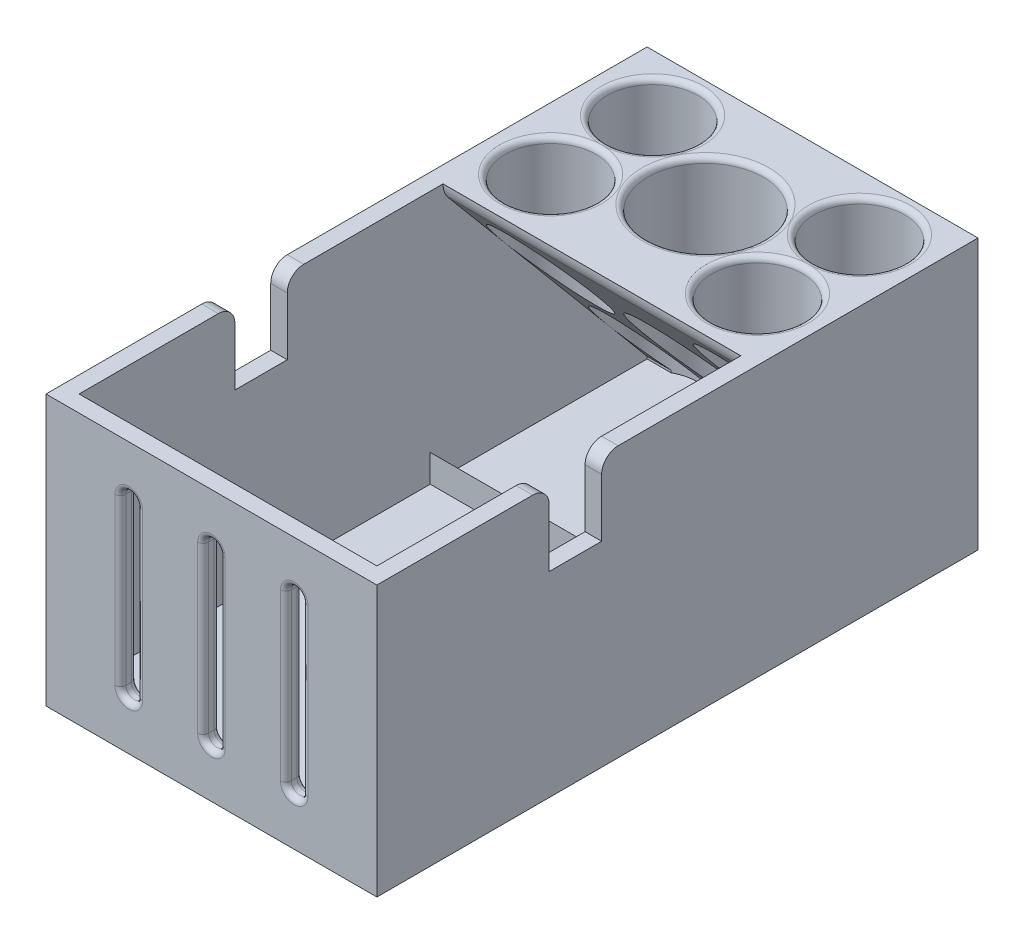
from build123d import *

# Parameters (mm, degrees)
BASE_PLATE_W              = 60
BASE_PLATE_H              = 106
BASE_DEPTH                = 3
SKETCH3_W                 = 3
SKETCH3_H                 = 106
BOSS_EXTRUDE2_DEPTH       = 46
SKETCH5_W                 = 54
SKETCH5_H                 = 3
BOSS_EXTRUDE3_DEPTH       = 46
SKETCH4_W                 = 54
SKETCH4_H                 = 37
BOSS_EXTRUDE4_DEPTH       = 1.5
BOSS_EXTRUDE5_DEPTH       = 54
CUT_EXTRUDE1_REACH        = 80.166
FLUXPENS_R                = 8.25
FILLET1_R                 = 1
FILLET3_R                 = 1
FILLET18_R                = 1
FILLET19_R                = 1
ROLLER_CUT_OUT_DEPTH      = 92.972822073
ROLLER_CUT_OUT_DEPTH_BACK = 92.972822073
SKETCH12_W                = 9.5
SKETCH12_H                = 13.5
SKETCH13_W                = 60
SKETCH13_H                = 49
BOSS_EXTRUDE6_DEPTH       = 3
CUT_EXTRUDE6_DEPTH        = 3
FILLET7_R                 = 1
FILLET8_R                 = 1
FILLET9_R                 = 1
FILLET10_R                = 3
FILLET11_R                = 3
FILLET12_R                = 3
FILLET13_R                = 3
FILLET14_R                = 4
FILLET15_R                = 1
FILLET16_R                = 1
FILLET17_R                = 1
TOOL_CATCHER_DEPTH        = 54
CUT_EXTRUDE7_REACH        = 82.231
SKETCH17_R                = 10.5
FILLET20_R                = 1


with BuildPart() as part:
    # Base Plate → Base (new body)
    with BuildSketch(Plane(origin=(0, 0, 0), x_dir=(1, 0, 0), z_dir=(0, 1, 0))):
        Rectangle(BASE_PLATE_W, BASE_PLATE_H)
    extrude(amount=BASE_DEPTH)

    # Sketch3 → Boss-Extrude2 (add)
    with BuildSketch(Plane(origin=(0, 3, 0), x_dir=(1, 0, 0), z_dir=(0, 1, 0))):
        with Locations((-28.5, 0)):
            Rectangle(SKETCH3_W, SKETCH3_H)
        with Locations((28.5, 0)):
            Rectangle(SKETCH3_W, SKETCH3_H)
    extrude(amount=BOSS_EXTRUDE2_DEPTH)

    # Sketch5 → Boss-Extrude3 (add)
    with BuildSketch(Plane(origin=(0, 3, 0), x_dir=(1, 0, 0), z_dir=(0, 1, 0))):
        with Locations((0, 51.5)):
            Rectangle(SKETCH5_W, SKETCH5_H)
    extrude(amount=BOSS_EXTRUDE3_DEPTH)

    # Sketch4 → Boss-Extrude4 (add)
    with BuildSketch(Plane(origin=(0, 49, 0), x_dir=(1, 0, 0), z_dir=(0, 1, 0))):
        with Locations((0, 31.5)):
            Rectangle(SKETCH4_W, SKETCH4_H)
    extrude(amount=-BOSS_EXTRUDE4_DEPTH)

    # Sketch7 → Boss-Extrude5 (add)
    with BuildSketch(Plane.ZY.offset(-27)):
        Polygon((-50, 47.5), (-13, 47.5), (-50, 3.405117074), align=None)
    extrude(amount=BOSS_EXTRUDE5_DEPTH)

    # Cut-Extrude1: up to this face of the body (flat: up to its plane)
    cut_extrude1_end = Plane(part.part.faces().sort_by_distance((0, 3, 1.5))[0])
    # FluxPens → Cut-Extrude1 (cut, up to the picked face)
    with BuildSketch(Plane(origin=(0, 49, 0), x_dir=(1, 0, 0), z_dir=(0, 1, 0)), mode=Mode.PRIVATE) as cut_extrude1_sk1:
        with Locations(Location((-18.75, 42.75, 0), (0, 0, 270))):
            Circle(FLUXPENS_R)
    cut_extrude1_tool1 = split(extrude(cut_extrude1_sk1.sketch, amount=-CUT_EXTRUDE1_REACH, mode=Mode.PRIVATE), bisect_by=cut_extrude1_end, keep=Keep.BOTH, mode=Mode.PRIVATE)
    # FluxPens → Cut-Extrude1 (cut, up to the picked face)
    with BuildSketch(Plane(origin=(0, 49, 0), x_dir=(1, 0, 0), z_dir=(0, 1, 0)), mode=Mode.PRIVATE) as cut_extrude1_sk2:
        with Locations(Location((-18.75, 24.25, 0), (0, 0, 270))):
            Circle(FLUXPENS_R)
    cut_extrude1_tool2 = split(extrude(cut_extrude1_sk2.sketch, amount=-CUT_EXTRUDE1_REACH, mode=Mode.PRIVATE), bisect_by=cut_extrude1_end, keep=Keep.BOTH, mode=Mode.PRIVATE)
    # FluxPens → Cut-Extrude1 (cut, up to the picked face)
    with BuildSketch(Plane(origin=(0, 49, 0), x_dir=(1, 0, 0), z_dir=(0, 1, 0)), mode=Mode.PRIVATE) as cut_extrude1_sk3:
        with Locations((18.75, 24.25)):
            Circle(FLUXPENS_R)
    cut_extrude1_tool3 = split(extrude(cut_extrude1_sk3.sketch, amount=-CUT_EXTRUDE1_REACH, mode=Mode.PRIVATE), bisect_by=cut_extrude1_end, keep=Keep.BOTH, mode=Mode.PRIVATE)
    # FluxPens → Cut-Extrude1 (cut, up to the picked face)
    with BuildSketch(Plane(origin=(0, 49, 0), x_dir=(1, 0, 0), z_dir=(0, 1, 0)), mode=Mode.PRIVATE) as cut_extrude1_sk4:
        with Locations((18.75, 42.75)):
            Circle(FLUXPENS_R)
    cut_extrude1_tool4 = split(extrude(cut_extrude1_sk4.sketch, amount=-CUT_EXTRUDE1_REACH, mode=Mode.PRIVATE), bisect_by=cut_extrude1_end, keep=Keep.BOTH, mode=Mode.PRIVATE)
    add(cut_extrude1_tool1.solids().sort_by(Axis((-18.75, 49, -42.75), (0, -1, 0)))[0], mode=Mode.SUBTRACT)
    add(cut_extrude1_tool2.solids().sort_by(Axis((-18.75, 49, -24.25), (0, -1, 0)))[0], mode=Mode.SUBTRACT)
    add(cut_extrude1_tool3.solids().sort_by(Axis((18.75, 49, -24.25), (0, -1, 0)))[0], mode=Mode.SUBTRACT)
    add(cut_extrude1_tool4.solids().sort_by(Axis((18.75, 49, -42.75), (0, -1, 0)))[0], mode=Mode.SUBTRACT)

    # Fillet1
    fillet1_edges = [part.edges().sort_by_distance(p)[0] for p in [
        (-18.75, 49, -51),
    ]]
    fillet(fillet1_edges, radius=FILLET1_R)

    # Fillet3
    fillet3_edges = [part.edges().sort_by_distance(p)[0] for p in [
        (-18.75, 49, -32.5),
    ]]
    fillet(fillet3_edges, radius=FILLET3_R - 0.0001)  # a hair under: the kernel refuses the full size

    # Fillet18
    fillet18_edges = [part.edges().sort_by_distance(p)[0] for p in [
        (10.5, 49, -42.75),
    ]]
    fillet(fillet18_edges, radius=FILLET18_R)

    # Fillet19
    fillet19_edges = [part.edges().sort_by_distance(p)[0] for p in [
        (10.5, 49, -24.25),
    ]]
    fillet(fillet19_edges, radius=FILLET19_R - 0.0001)  # a hair under: the kernel refuses the full size

    # Sketch12 → Roller Cut Out (cut, two sides: drawn at the far end of the back side and taken through both)
    with BuildSketch(Plane(origin=(-27, 0, 0), x_dir=(0, 0, -1), z_dir=(1, 0, 0)).offset(-ROLLER_CUT_OUT_DEPTH_BACK)):
        with Locations((-20, 42.25)):
            Rectangle(SKETCH12_W, SKETCH12_H)
    extrude(amount=ROLLER_CUT_OUT_DEPTH + ROLLER_CUT_OUT_DEPTH_BACK, mode=Mode.SUBTRACT)

    # Sketch13 → Boss-Extrude6 (add)
    with BuildSketch(Plane.XY.offset(53)):
        with Locations((0, 24.5)):
            Rectangle(SKETCH13_W, SKETCH13_H)
    extrude(amount=BOSS_EXTRUDE6_DEPTH)

    # Sketch14 → Cut-Extrude6 (cut)
    with BuildSketch(Plane.XY.offset(56)):
        with BuildLine():
            Line((-16.5, 9.5), (-16.5, 39.5))
            ThreePointArc((-16.5, 39.5), (-15, 41), (-13.5, 39.5))
            Line((-13.5, 39.5), (-13.5, 9.5))
            ThreePointArc((-13.5, 9.5), (-15, 8), (-16.5, 9.5))
        make_face()
        with BuildLine():
            Line((13.5, 9.5), (13.5, 39.5))
            ThreePointArc((13.5, 39.5), (15, 41), (16.5, 39.5))
            Line((16.5, 39.5), (16.5, 9.5))
            ThreePointArc((16.5, 9.5), (15, 8), (13.5, 9.5))
        make_face()
        with BuildLine():
            Line((-1.5, 39.5), (-1.5, 9.5))
            ThreePointArc((-1.5, 9.5), (0, 8), (1.5, 9.5))
            Line((1.5, 9.5), (1.5, 39.5))
            ThreePointArc((1.5, 39.5), (0, 41), (-1.5, 39.5))
        make_face()
    extrude(amount=-CUT_EXTRUDE6_DEPTH, mode=Mode.SUBTRACT)

    # Fillet7
    fillet7_edges = [part.edges().sort_by_distance(p)[0] for p in [
        (-15, 8, 53),
        (-16.5, 24.5, 53),
        (-15, 41, 53),
        (-13.5, 24.5, 53),
    ]]
    fillet(fillet7_edges, radius=FILLET7_R)

    # Fillet8
    fillet8_edges = [part.edges().sort_by_distance(p)[0] for p in [
        (0, 41, 53),
        (1.5, 24.5, 53),
        (0, 8, 53),
        (-1.5, 24.5, 53),
    ]]
    fillet(fillet8_edges, radius=FILLET8_R)

    # Fillet9
    fillet9_edges = [part.edges().sort_by_distance(p)[0] for p in [
        (15, 8, 53),
        (13.5, 24.5, 53),
        (15, 41, 53),
        (16.5, 24.5, 53),
    ]]
    fillet(fillet9_edges, radius=FILLET9_R)

    # Fillet10
    fillet10_edges = [part.edges().sort_by_distance(p)[0] for p in [
        (-28.5, 49, 15.25),
    ]]
    fillet(fillet10_edges, radius=FILLET10_R)

    # Fillet11
    fillet11_edges = [part.edges().sort_by_distance(p)[0] for p in [
        (-28.5, 49, 24.75),
    ]]
    fillet(fillet11_edges, radius=FILLET11_R)

    # Fillet12
    fillet12_edges = [part.edges().sort_by_distance(p)[0] for p in [
        (28.5, 49, 15.25),
    ]]
    fillet(fillet12_edges, radius=FILLET12_R)

    # Fillet13
    fillet13_edges = [part.edges().sort_by_distance(p)[0] for p in [
        (28.5, 49, 24.75),
    ]]
    fillet(fillet13_edges, radius=FILLET13_R)

    # Fillet14
    fillet14_edges = [part.edges().sort_by_distance(p)[0] for p in [
        (0, 47.5, -13),
    ]]
    fillet(fillet14_edges, radius=FILLET14_R)

    # Fillet15
    fillet15_edges = [part.edges().sort_by_distance(p)[0] for p in [
        (0, 41, 56),
        (-1.5, 24.5, 56),
        (0, 8, 56),
        (1.5, 24.5, 56),
    ]]
    fillet(fillet15_edges, radius=FILLET15_R)

    # Fillet16
    fillet16_edges = [part.edges().sort_by_distance(p)[0] for p in [
        (-15, 8, 56),
        (-13.5, 24.5, 56),
        (-15, 41, 56),
        (-16.5, 24.5, 56),
    ]]
    fillet(fillet16_edges, radius=FILLET16_R)

    # Fillet17
    fillet17_edges = [part.edges().sort_by_distance(p)[0] for p in [
        (15, 8, 56),
        (16.5, 24.5, 56),
        (15, 41, 56),
        (13.5, 24.5, 56),
    ]]
    fillet(fillet17_edges, radius=FILLET17_R)

    # Sketch16 → Tool Catcher (add)
    with BuildSketch(Plane(origin=(-27, 0, 0), x_dir=(0, 0, -1), z_dir=(1, 0, 0))):
        Polygon((10.668461709, 3), (10.668461709, 8), (13, 3), align=None)
    extrude(amount=TOOL_CATCHER_DEPTH)

    # Cut-Extrude7: up to this plane
    cut_extrude7_end = Plane(origin=(-84.561781594, 47.5, -13), z_dir=(0, 0.6427876096865348, -0.7660444431189817))
    # Sketch17 → Cut-Extrude7 (cut, up to the surface)
    with BuildSketch(Plane(origin=(0, 49, 0), x_dir=(1, 0, 0), z_dir=(0, 1, 0)), mode=Mode.PRIVATE) as cut_extrude7_sk1:
        with Locations(Location((0, 33.58601859, 0), (0, 0, 270))):
            Circle(SKETCH17_R)
    cut_extrude7_tool1 = split(extrude(cut_extrude7_sk1.sketch, amount=-CUT_EXTRUDE7_REACH, mode=Mode.PRIVATE), bisect_by=cut_extrude7_end, keep=Keep.BOTH, mode=Mode.PRIVATE)
    add(cut_extrude7_tool1.solids().sort_by_distance((0, 49, -33.586019))[0], mode=Mode.SUBTRACT)

    # Fillet20
    fillet20_edges = [part.edges().sort_by_distance(p)[0] for p in [
        (0, 49, -44.08601859),
    ]]
    fillet(fillet20_edges, radius=FILLET20_R)


solid = part.part
